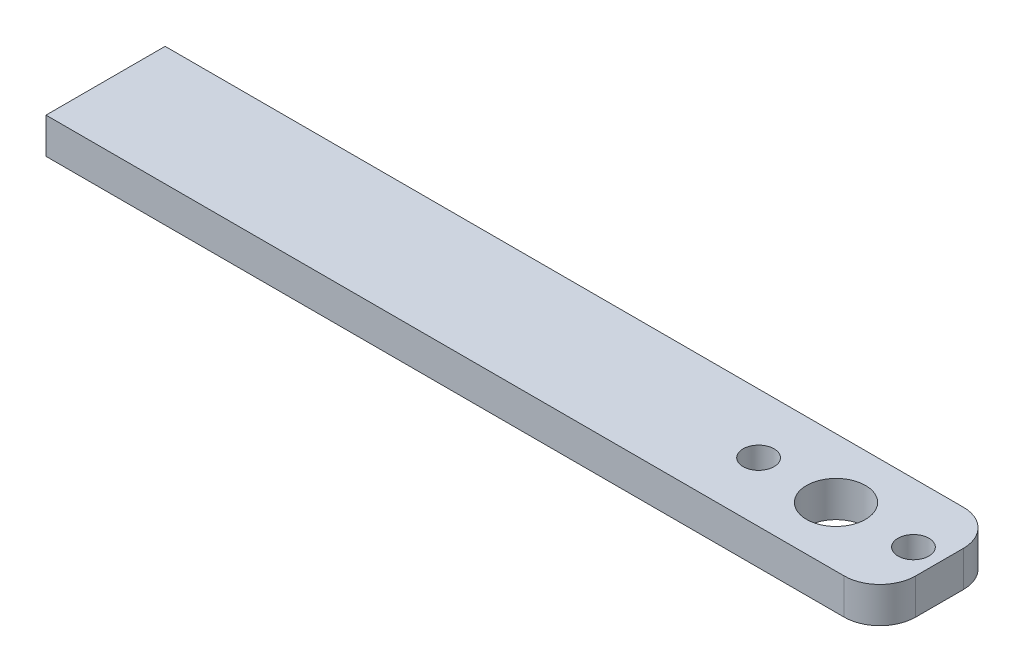
from build123d import *

# Parameters (mm, degrees)
SKETCH1_W           = 70
SKETCH1_H           = 10
BOSS_EXTRUDE1_DEPTH = 3
SKETCH2_R           = 2.472864358
SKETCH2_R_2         = 1.3
CUT_EXTRUDE1_DEPTH  = 3
FILLET1_R           = 3


with BuildPart() as part:
    # Sketch1 → Boss-Extrude1 (new body)
    with BuildSketch(Plane(origin=(0, 0, 0), x_dir=(1, 0, 0), z_dir=(0, 1, 0))):
        Rectangle(SKETCH1_W, SKETCH1_H)
    extrude(amount=BOSS_EXTRUDE1_DEPTH)

    # Sketch2 → Cut-Extrude1 (cut)
    with BuildSketch(Plane(origin=(0, 3, 0), x_dir=(1, 0, 0), z_dir=(0, 1, 0))):
        with Locations((26.315616253, 0)):
            Circle(SKETCH2_R)
        with Locations((32.815616253, 0)):
            Circle(SKETCH2_R_2)
        with Locations((19.815616253, 0)):
            Circle(SKETCH2_R_2)
    extrude(amount=-CUT_EXTRUDE1_DEPTH, mode=Mode.SUBTRACT)

    # Fillet1
    fillet1_edges = [part.edges().sort_by_distance(p)[0] for p in [
        (35, 1.5, 5),
        (35, 1.5, -5),
    ]]
    fillet(fillet1_edges, radius=FILLET1_R)


solid = part.part
